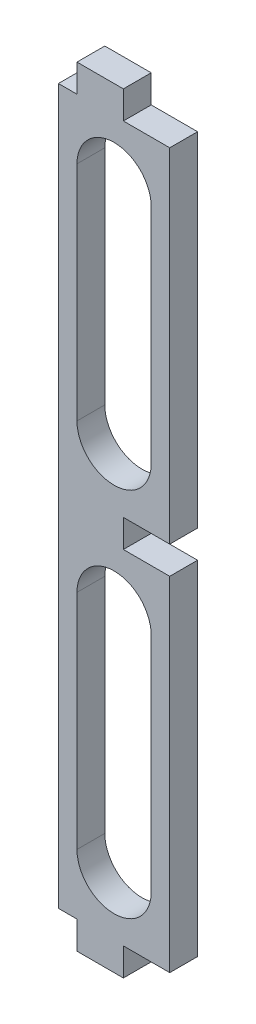
from build123d import *

# Parameters (mm, degrees)
BOSS_EXTRU_1_DEPTH      = 3
ENL_V_MAT_EXTRU_1_DEPTH = 119.190524155


with BuildPart() as part:
    # Esquisse1 → Boss.-Extru.1 (new body)
    with BuildSketch(Plane.XY):
        Polygon((-6, 0), (6, 0), (6, 17.5), (1, 17.5), (1, 20.5), (6, 20.5), (6, 57.5), (1, 57.5), (1, 60.5), (6, 60.5), (6, 97.5), (1, 97.5), (1, 100.5), (6, 100.5), (6, 118), (-6, 118), align=None)
        with BuildLine():
            Line((4, 51), (4, 27))
            ThreePointArc((4, 27), (0, 23), (-4, 27))
            Line((-4, 27), (-4, 51))
            ThreePointArc((-4, 51), (0, 55), (4, 51))
        make_face(mode=Mode.SUBTRACT)
        with BuildLine():
            Line((4, 67), (4, 91))
            ThreePointArc((4, 91), (0, 95), (-4, 91))
            Line((-4, 91), (-4, 67))
            ThreePointArc((-4, 67), (0, 63), (4, 67))
        make_face(mode=Mode.SUBTRACT)
    extrude(amount=BOSS_EXTRU_1_DEPTH)

    # Esquisse2 → Enlèv. mat.-Extru.1 (cut, through all)
    with BuildSketch(Plane.XY.offset(3)):
        Polygon((-6, 118), (6, 118), (6, 100.5), (-4, 100.5), (-4, 97.5), (-6, 97.5), (-6, 100.5), align=None)
        Polygon((-6, 0), (6, 0), (6, 17.5), (-4, 17.5), (-4, 20.5), (-6, 20.5), (-6, 17.5), align=None)
    extrude(amount=-ENL_V_MAT_EXTRU_1_DEPTH, mode=Mode.SUBTRACT)


solid = part.part
